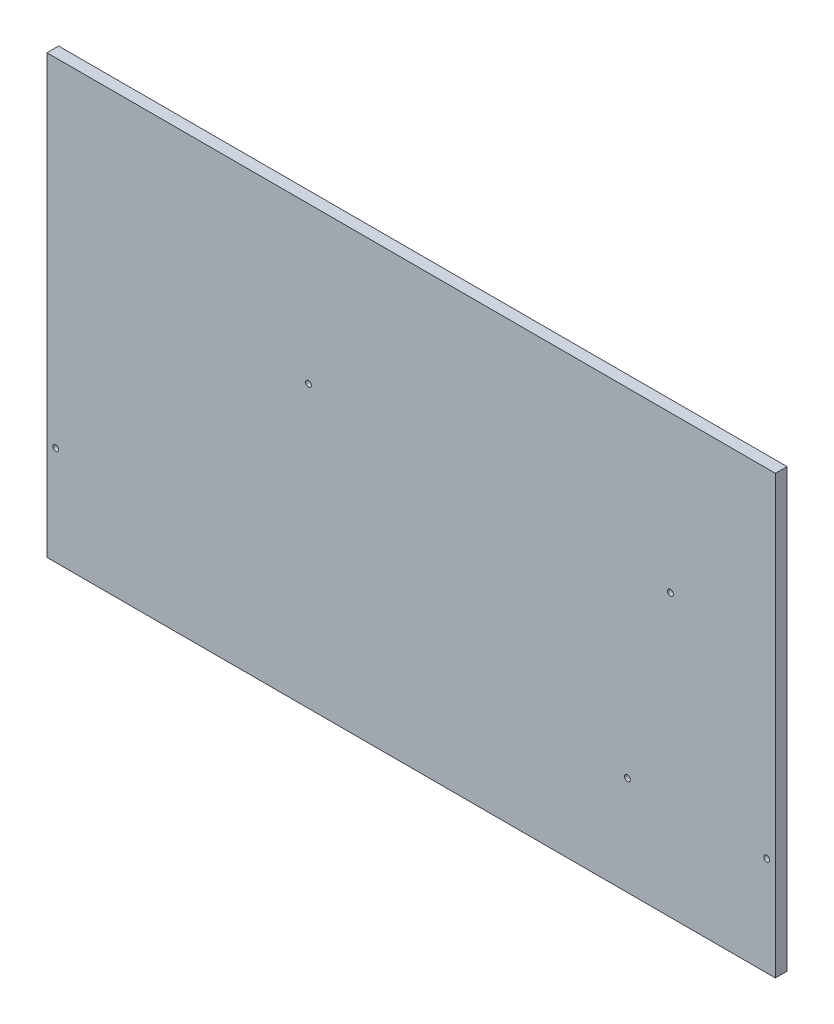
from build123d import *

# Parameters (mm, degrees)
SKETCH1_W           = 200
SKETCH1_H           = 150
BOSS_EXTRUDE1_DEPTH = 4
SKETCH2_W           = 4
SKETCH2_H           = 150
BOSS_EXTRUDE2_DEPTH = 50
SKETCH3_R           = 1
CUT_EXTRUDE1_DEPTH  = 21
SKETCH4_R           = 1
CUT_EXTRUDE2_DEPTH  = 21
SKETCH5_R           = 1
CUT_EXTRUDE3_DEPTH  = 21
SKETCH6_R           = 1
CUT_EXTRUDE4_DEPTH  = 188.3873461


with BuildPart() as part:
    # Sketch1 → Boss-Extrude1 (new body)
    with BuildSketch(Plane.XY):
        with Locations((0.223214286, -36.941964286)):
            Rectangle(SKETCH1_W, SKETCH1_H)
    extrude(amount=BOSS_EXTRUDE1_DEPTH)

    # Sketch2 → Boss-Extrude2 (add)
    with BuildSketch(Plane(origin=(100.223214286, 0, 0), x_dir=(0, 0, -1), z_dir=(1, 0, 0))):
        with Locations((-2, -36.941964286)):
            Rectangle(SKETCH2_W, SKETCH2_H)
    extrude(amount=BOSS_EXTRUDE2_DEPTH)

    # Sketch3 → Cut-Extrude1 (cut)
    with BuildSketch(Plane(origin=(0, 0, 0), x_dir=(-1, 0, 0), z_dir=(0, 0, -1))):
        with Locations((96.776785714, -77.941964286)):
            Circle(SKETCH3_R)
    extrude(amount=-CUT_EXTRUDE1_DEPTH, mode=Mode.SUBTRACT)

    # Sketch4 → Cut-Extrude2 (cut)
    with BuildSketch(Plane(origin=(0, 0, 0), x_dir=(-1, 0, 0), z_dir=(0, 0, -1))):
        with Locations((-147.223214286, -77.941964286)):
            Circle(SKETCH4_R)
    extrude(amount=-CUT_EXTRUDE2_DEPTH, mode=Mode.SUBTRACT)

    # Sketch5 → Cut-Extrude3 (cut)
    with BuildSketch(Plane(origin=(0, 0, 0), x_dir=(-1, 0, 0), z_dir=(0, 0, -1))):
        with Locations((-99.423214286, -77.941964286)):
            Circle(SKETCH5_R)
    extrude(amount=-CUT_EXTRUDE3_DEPTH, mode=Mode.SUBTRACT)

    # Sketch6 → Cut-Extrude4 (cut, through all)
    with BuildSketch(Plane.XY.offset(4)):
        with Locations((114.203214286, -15.441964286)):
            Circle(SKETCH6_R)
        with Locations((-10.026785714, -15.441964286)):
            Circle(SKETCH6_R)
    extrude(amount=-CUT_EXTRUDE4_DEPTH, mode=Mode.SUBTRACT)


solid = part.part
